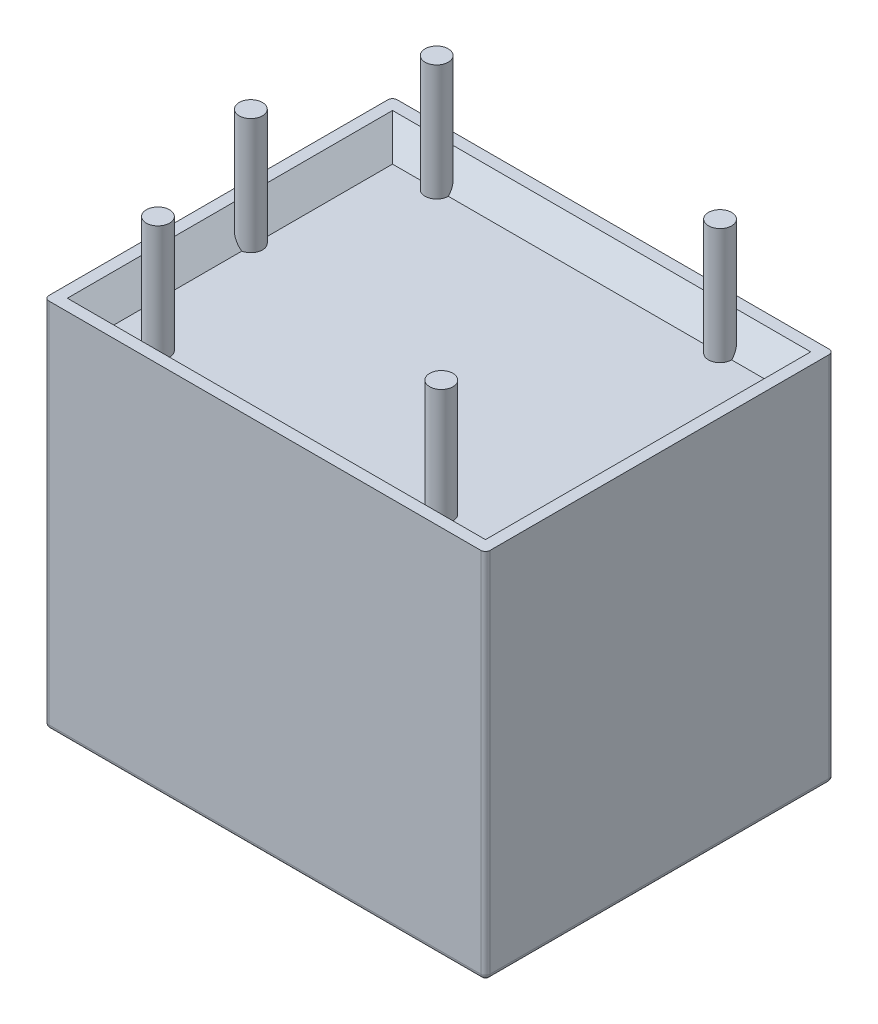
from build123d import *

# Parameters (mm, degrees)
SKETCH2_W           = 19
SKETCH2_H           = 15
BOSS_EXTRUDE1_DEPTH = 16
SKETCH3_W           = 18
SKETCH3_H           = 14
CUT_EXTRUDE1_DEPTH  = 1
CHAMFER1_SIZE       = 1
SKETCH4_R           = 0.5
BOSS_EXTRUDE3_DEPTH = 5
FILLET1_R           = 0.2


with BuildPart() as part:
    # Sketch2 → Boss-Extrude1 (new body)
    with BuildSketch(Plane(origin=(0, 0, 0), x_dir=(1, 0, 0), z_dir=(0, 1, 0))):
        Rectangle(SKETCH2_W, SKETCH2_H)
    extrude(amount=BOSS_EXTRUDE1_DEPTH)

    # Sketch3 → Cut-Extrude1 (cut)
    with BuildSketch(Plane(origin=(0, 16, 0), x_dir=(1, 0, 0), z_dir=(0, 1, 0))):
        Rectangle(SKETCH3_W, SKETCH3_H)
    extrude(amount=-CUT_EXTRUDE1_DEPTH, mode=Mode.SUBTRACT)

    # Chamfer1
    chamfer1_edges = [part.edges().sort_by_distance(p)[0] for p in [
        (0, 15, 7),
        (9, 15, 0),
        (0, 15, -7),
        (-9, 15, 0),
    ]]
    chamfer(chamfer1_edges, length=CHAMFER1_SIZE - 0.0001)  # a hair under: the kernel refuses the full size

    # Sketch4 → Boss-Extrude3 (add)
    with BuildSketch(Plane(origin=(0, 15, 0), x_dir=(1, 0, 0), z_dir=(0, 1, 0))):
        with Locations(Location((-8.1, 0, 0), (0, 0, 78.463040967))):
            Circle(SKETCH4_R)
        with Locations((-6.1, 6)):
            Circle(SKETCH4_R)
        with Locations((6.1, 6)):
            Circle(SKETCH4_R)
    boss_extrude3 = extrude(amount=BOSS_EXTRUDE3_DEPTH)

    # Mirror1: Boss-Extrude3 across plane
    add(boss_extrude3.mirror(Plane.XY))

    # Fillet1
    fillet1_edges = [part.edges().sort_by_distance(p)[0] for p in [
        (0, 0, 7.5),
        (-9.5, 0, 0),
        (0, 0, -7.5),
        (9.5, 0, 0),
        (9.5, 8, 7.5),
        (-9.5, 8, 7.5),
        (-9.5, 8, -7.5),
        (9.5, 8, -7.5),
    ]]
    fillet(fillet1_edges, radius=FILLET1_R)


solid = part.part
